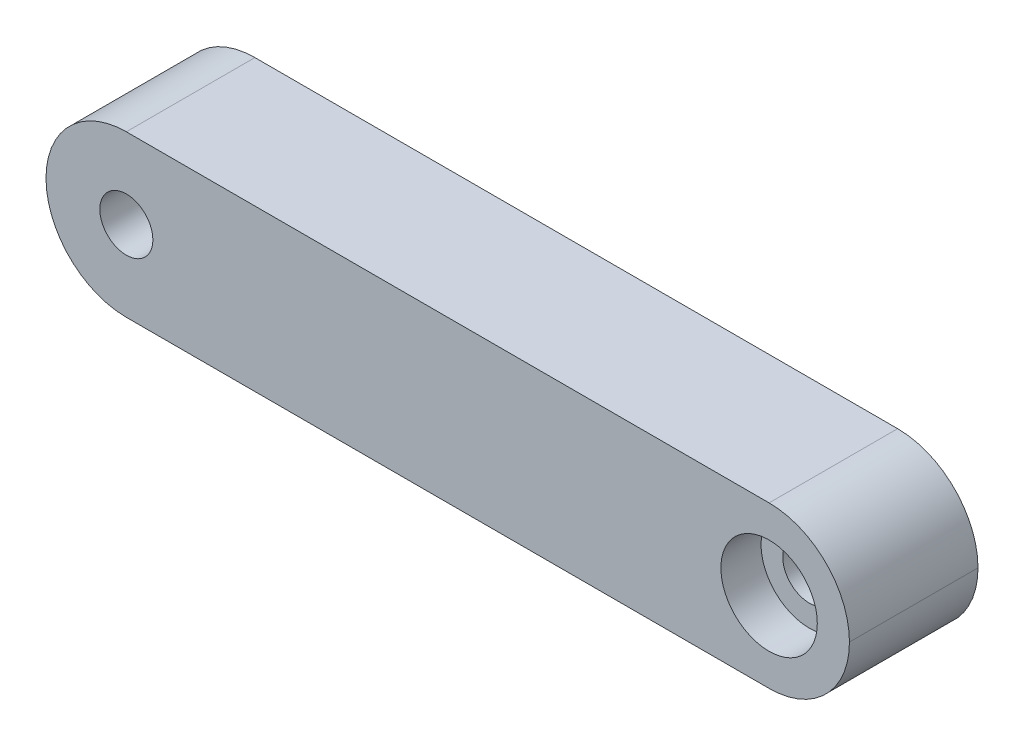
from build123d import *

# Parameters (mm, degrees)
SKICA1_W                 = 50
SKICA1_H                 = 10
P_IDAT_VYSUNUT_M1_DEPTH  = 8
SKICA2_R                 = 1.65
ODEBRAT_VYSUNUT_M1_DEPTH = 52.613951602
ZAOBLIT2_R               = 5
SKICA3_R                 = 3
ODEBRAT_VYSUNUT_M2_DEPTH = 2.5
ODEBRAT_VYSUNUT_M3_DEPTH = 2.5


with BuildPart() as part:
    # Skica1 → Přidat vysunutím1 (new body)
    with BuildSketch(Plane.XY):
        with Locations((25, 5)):
            Rectangle(SKICA1_W, SKICA1_H)
    extrude(amount=P_IDAT_VYSUNUT_M1_DEPTH)

    # Skica2 → Odebrat vysunutím1 (cut, through all)
    with BuildSketch(Plane.XY.offset(8)):
        with Locations((5, 5)):
            Circle(SKICA2_R)
        with Locations((45, 5)):
            Circle(SKICA2_R)
    extrude(amount=-ODEBRAT_VYSUNUT_M1_DEPTH, mode=Mode.SUBTRACT)

    # Zaoblit2
    zaoblit2_edges = [part.edges().sort_by_distance(p)[0] for p in [
        (50, 0, 4),
        (50, 10, 4),
        (0, 0, 4),
        (0, 10, 4),
    ]]
    fillet(zaoblit2_edges, radius=ZAOBLIT2_R - 0.0001)  # a hair under: the kernel refuses the full size

    # Skica3 → Odebrat vysunutím2 (cut)
    with BuildSketch(Plane.XY.offset(8)):
        with Locations((45, 5)):
            Circle(SKICA3_R)
    extrude(amount=-ODEBRAT_VYSUNUT_M2_DEPTH, mode=Mode.SUBTRACT)

    # Skica4 → Odebrat vysunutím3 (cut)
    with BuildSketch(Plane(origin=(0, 0, 0), x_dir=(-1, 0, 0), z_dir=(0, 0, -1))):
        Polygon((-6.58771324, 7.75), (-8.175426481, 5), (-6.58771324, 2.25), (-3.41228676, 2.25), (-1.824573519, 5), (-3.41228676, 7.75), align=None)
    extrude(amount=-ODEBRAT_VYSUNUT_M3_DEPTH, mode=Mode.SUBTRACT)


solid = part.part
